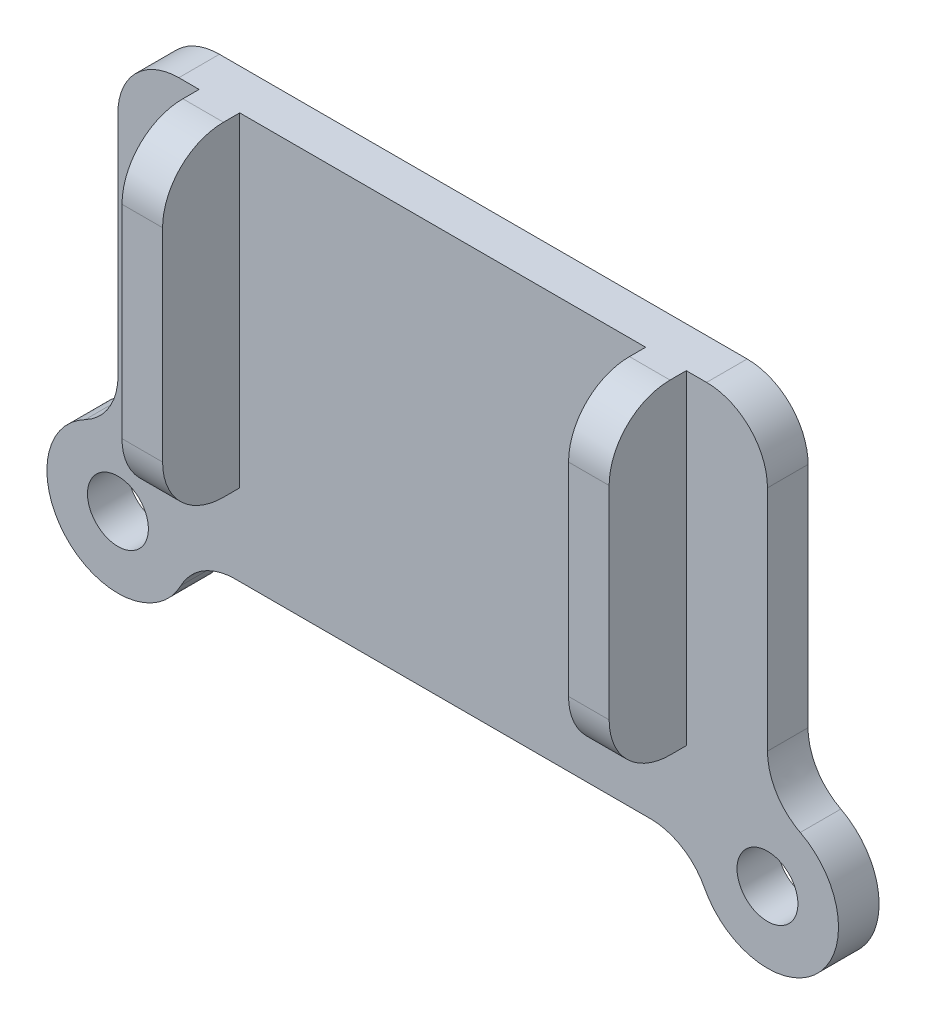
from build123d import *

# Parameters (mm, degrees)
SKETCH_1_W            = 32
SKETCH_1_H            = 20
EXTRUDE_1_DEPTH       = 2
SKETCH_2_R            = 3.5
EXTRUDE_2_DEPTH       = 2
HOLE_WIZARD_3_0_3_1_D = 3
SKETCH_5_W            = 2
SKETCH_5_H            = 16
EXTRUDE_3_DEPTH       = 3.8
FILLET_1_DEPTH        = 2
FILLET_START          = -1
FILLET_1_2_DEPTH      = 6.8
FILLET_START_2        = -12
FILLET_1_3_DEPTH      = 24


with BuildPart() as part:
    # 草圖1 → 填料-伸長1 (new body)
    with BuildSketch(Plane.XY):
        Rectangle(SKETCH_1_W, SKETCH_1_H)
    extrude(amount=EXTRUDE_1_DEPTH)

    # 草圖2 → 填料-伸長2 (add)
    with BuildSketch(Plane(origin=(0, 0, 0), x_dir=(-1, 0, 0), z_dir=(0, 0, -1))):
        with Locations((-16, -10)):
            Circle(SKETCH_2_R)
    extrude_2 = extrude(amount=-EXTRUDE_2_DEPTH)

    # Ø3.0 (3) 直徑孔1 (through all)
    with Locations(Plane(origin=(0, 0, 0), x_dir=(-1, 0, 0), z_dir=(0, 0, -1))):
        with Locations((-16, -10)):
            hole_wizard_3_0_3_1 = Hole(HOLE_WIZARD_3_0_3_1_D / 2)

    # 鏡射1: 填料-伸長2, Ø3.0 (3) 直徑孔1 across plane
    add(extrude_2.mirror(Plane(origin=(0, 0, 0), x_dir=(0, 0, 1), z_dir=(1, 0, 0))))
    add(hole_wizard_3_0_3_1.mirror(Plane(origin=(0, 0, 0), x_dir=(0, 0, 1), z_dir=(1, 0, 0))), mode=Mode.SUBTRACT)

    # 草圖5 → 填料-伸長3 (add)
    with BuildSketch(Plane.XY.offset(2)):
        with Locations((-11, 2)):
            Rectangle(SKETCH_5_W, SKETCH_5_H)
    extrude_3 = extrude(amount=EXTRUDE_3_DEPTH)

    # 鏡射2: 填料-伸長3 across plane
    add(extrude_3.mirror(Plane(origin=(0, 0, 0), x_dir=(0, 0, 1), z_dir=(1, 0, 0))))

    # 圓角1: read off the stored shape, not the designer's step
    # 圓角1 outline → 圓角1 (add)
    with BuildSketch(Plane.XY):
        with BuildLine():
            add(Edge.make_bspline(
                [(-17.615384615, -6.895079301), (-16, -6.054649639), (-16, -4.233718703)],
                knots=[0, 0, 0, 1, 1, 1], degree=2, weights=[1, 0.854850414, 1]))
            ThreePointArc((-17.615384615, -6.895079301), (-16.831497912, -6.600204238), (-16, -6.5))
            Line((-16, -6.5), (-16, -4.233718703))
        make_face()
        with BuildLine():
            ThreePointArc((-12.5, -10), (-12.600204238, -10.831497912), (-12.895079301, -11.615384615))
            add(Edge.make_bspline(
                [(-10.233718703, -10), (-12.054649639, -10), (-12.895079301, -11.615384615)],
                knots=[0, 0, 0, 1, 1, 1], degree=2, weights=[1, 0.854850414, 1]))
            Line((-10.233718703, -10), (-12.5, -10))
        make_face()
        with BuildLine():
            Line((12.5, -10), (10.233718703, -10))
            add(Edge.make_bspline(
                [(12.895079301, -11.615384615), (12.054649639, -10), (10.233718703, -10)],
                knots=[0, 0, 0, 1, 1, 1], degree=2, weights=[1, 0.854850414, 1]))
            ThreePointArc((12.895079301, -11.615384615), (12.600204238, -10.831497912), (12.5, -10))
        make_face()
        with BuildLine():
            ThreePointArc((16, -6.5), (16.831497912, -6.600204238), (17.615384615, -6.895079301))
            add(Edge.make_bspline(
                [(16, -4.233718703), (16, -6.054649639), (17.615384615, -6.895079301)],
                knots=[0, 0, 0, 1, 1, 1], degree=2, weights=[1, 0.854850414, 1]))
            Line((16, -4.233718703), (16, -6.5))
        make_face()
    extrude(amount=FILLET_1_DEPTH)

    # Fillet 1 2 outline → Fillet 1 2 (cut)
    with BuildSketch(Plane.XY.offset(FILLET_START)):
        with BuildLine():
            Line((-16, 10), (-16, 7))
            add(Edge.make_bspline(
                [(-16, 7), (-16, 10), (-13, 10)],
                knots=[0, 0, 0, 1, 1, 1], degree=2, weights=[1, 0.707106781, 1]))
            Line((-13, 10), (-16, 10))
        make_face()
        with BuildLine():
            add(Edge.make_bspline(
                [(13, 10), (16, 10), (16, 7)],
                knots=[0, 0, 0, 1, 1, 1], degree=2, weights=[1, 0.707106781, 1]))
            Line((16, 7), (16, 10))
            Line((16, 10), (13, 10))
        make_face()
    extrude(amount=FILLET_1_2_DEPTH, mode=Mode.SUBTRACT)

    # Fillet 1 3 outline → Fillet 1 3 (cut)
    with BuildSketch(Plane.YZ.offset(FILLET_START_2)):
        with BuildLine():
            add(Edge.make_bspline(
                [(10, 2.8), (10, 5.8), (7, 5.8)],
                knots=[0, 0, 0, 1, 1, 1], degree=2, weights=[1, 0.707106781, 1]))
            Line((10, 2.8), (10, 5.8))
            Line((10, 5.8), (7, 5.8))
        make_face()
        with BuildLine():
            add(Edge.make_bspline(
                [(-6, 2.8), (-6, 5.8), (-3, 5.8)],
                knots=[0, 0, 0, 1, 1, 1], degree=2, weights=[1, 0.707106781, 1]))
            Line((-3, 5.8), (-6, 5.8))
            Line((-6, 5.8), (-6, 2.8))
        make_face()
    extrude(amount=FILLET_1_3_DEPTH, mode=Mode.SUBTRACT)


solid = part.part
